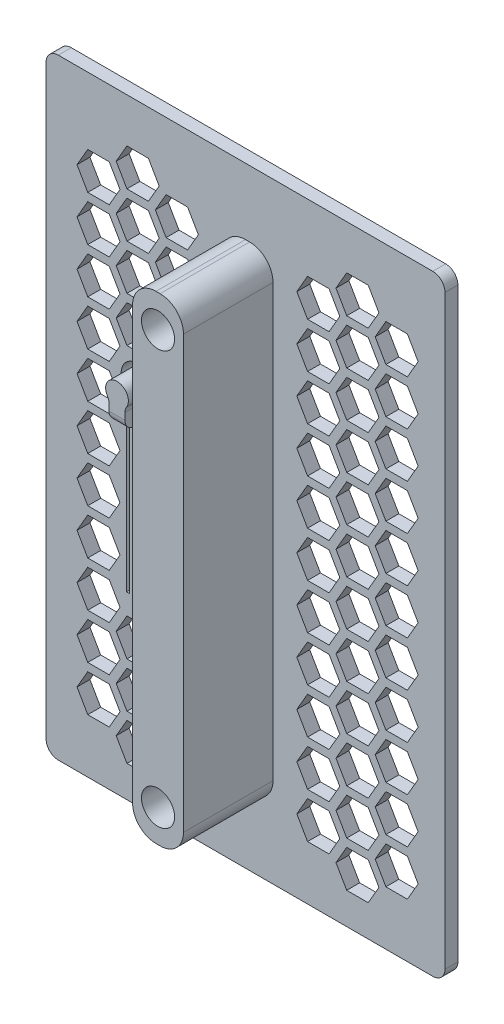
from build123d import *

# Parameters (mm, degrees)
SKETCH1_W           = 49
SKETCH1_H           = 75
BOSS_EXTRUDE1_DEPTH = 1.5875
BOSS_EXTRUDE2_DEPTH = 11
SKETCH3_R           = 2.032
CUT_EXTRUDE1_DEPTH  = 9.525
FILLET1_R           = 1.5
CUT_EXTRUDE2_DEPTH  = 47.52897115
BOSS_EXTRUDE3_DEPTH = 2.54
FILLET2_R           = 1.27


with BuildPart() as part:
    # Sketch1 → Boss-Extrude1 (new body)
    with BuildSketch(Plane.XY):
        Rectangle(SKETCH1_W, SKETCH1_H)
    extrude(amount=BOSS_EXTRUDE1_DEPTH)

    # Sketch2 → Boss-Extrude2 (add)
    with BuildSketch(Plane.XY.offset(1.5875)):
        with BuildLine():
            Line((0, -29.373), (0.5, -29.373))
            ThreePointArc((0.5, -29.373), (2.531517782, -28.531517782), (3.373, -26.5))
            Line((3.373, -26.5), (3.373, 26.5))
            ThreePointArc((3.373, 26.5), (2.531517782, 28.531517782), (0.5, 29.373))
            Line((0.5, 29.373), (0, 29.373))
            ThreePointArc((0, 29.373), (-2.031517782, 28.531517782), (-2.873, 26.5))
            Line((-2.873, 26.5), (-2.873, -26.5))
            ThreePointArc((-2.873, -26.5), (-2.031517782, -28.531517782), (0, -29.373))
        make_face()
    extrude(amount=BOSS_EXTRUDE2_DEPTH)

    # Sketch3 → Cut-Extrude1 (cut)
    with BuildSketch(Plane.XY.offset(12.5875)):
        with Locations((0.25, 25.4)):
            Circle(SKETCH3_R)
        with Locations((0.25, -25.4)):
            Circle(SKETCH3_R)
    extrude(amount=-CUT_EXTRUDE1_DEPTH, mode=Mode.SUBTRACT)

    # Fillet1
    fillet1_edges = [part.edges().sort_by_distance(p)[0] for p in [
        (-24.5, 37.5, 0.79375),
        (24.5, 37.5, 0.79375),
        (24.5, -37.5, 0.79375),
        (-24.5, -37.5, 0.79375),
    ]]
    fillet(fillet1_edges, radius=FILLET1_R)

    # Sketch4 → Cut-Extrude2 (cut, through all)
    with BuildSketch(Plane(origin=(0, 0, 0), x_dir=(-1, 0, 0), z_dir=(0, 0, -1))):
        Polygon((-16.389645431, -31.346033363), (-15.069822715, -33.632033363), (-12.430177285, -33.632033363), (-11.110354569, -31.346033363), (-12.430177285, -29.060033363), (-15.069822715, -29.060033363), align=None)
        Polygon((-21.201499081, -28.567908363), (-19.881676365, -30.853908363), (-17.242030934, -30.853908363), (-15.922208219, -28.567908363), (-17.242030934, -26.281908363), (-19.881676365, -26.281908363), align=None)
        Polygon((-10.257969066, -30.853908363), (-7.618323635, -30.853908363), (-6.298500919, -28.567908363), (-7.618323635, -26.281908363), (-10.257969066, -26.281908363), (-11.577791781, -28.567908363), align=None)
        Polygon((-10.257969066, -20.725658363), (-11.577791781, -23.011658363), (-10.257969066, -25.297658363), (-7.618323635, -25.297658363), (-6.298500919, -23.011658363), (-7.618323635, -20.725658363), align=None)
        Polygon((-11.110354569, -25.789783363), (-12.430177285, -23.503783363), (-15.069822715, -23.503783363), (-16.389645431, -25.789783363), (-15.069822715, -28.075783363), (-12.430177285, -28.075783363), align=None)
        Polygon((-17.242030934, -25.297658363), (-15.922208219, -23.011658363), (-17.242030934, -20.725658363), (-19.881676365, -20.725658363), (-21.201499081, -23.011658363), (-19.881676365, -25.297658363), align=None)
        Polygon((-10.257969066, -15.169408363), (-11.577791781, -17.455408363), (-10.257969066, -19.741408363), (-7.618323635, -19.741408363), (-6.298500919, -17.455408363), (-7.618323635, -15.169408363), align=None)
        Polygon((-11.110354569, -20.233533363), (-12.430177285, -17.947533363), (-15.069822715, -17.947533363), (-16.389645431, -20.233533363), (-15.069822715, -22.519533363), (-12.430177285, -22.519533363), align=None)
        Polygon((-17.242030934, -19.741408363), (-15.922208219, -17.455408363), (-17.242030934, -15.169408363), (-19.881676365, -15.169408363), (-21.201499081, -17.455408363), (-19.881676365, -19.741408363), align=None)
        Polygon((-10.257969066, -9.613158363), (-11.577791781, -11.899158363), (-10.257969066, -14.185158363), (-7.618323635, -14.185158363), (-6.298500919, -11.899158363), (-7.618323635, -9.613158363), align=None)
        Polygon((-11.110354569, -14.677283363), (-12.430177285, -12.391283363), (-15.069822715, -12.391283363), (-16.389645431, -14.677283363), (-15.069822715, -16.963283363), (-12.430177285, -16.963283363), align=None)
        Polygon((-17.242030934, -14.185158363), (-15.922208219, -11.899158363), (-17.242030934, -9.613158363), (-19.881676365, -9.613158363), (-21.201499081, -11.899158363), (-19.881676365, -14.185158363), align=None)
        Polygon((-10.257969066, -4.056908363), (-11.577791781, -6.342908363), (-10.257969066, -8.628908363), (-7.618323635, -8.628908363), (-6.298500919, -6.342908363), (-7.618323635, -4.056908363), align=None)
        Polygon((-11.110354569, -9.121033363), (-12.430177285, -6.835033363), (-15.069822715, -6.835033363), (-16.389645431, -9.121033363), (-15.069822715, -11.407033363), (-12.430177285, -11.407033363), align=None)
        Polygon((-17.242030934, -8.628908363), (-15.922208219, -6.342908363), (-17.242030934, -4.056908363), (-19.881676365, -4.056908363), (-21.201499081, -6.342908363), (-19.881676365, -8.628908363), align=None)
        Polygon((-10.257969066, 1.499341637), (-11.577791781, -0.786658363), (-10.257969066, -3.072658363), (-7.618323635, -3.072658363), (-6.298500919, -0.786658363), (-7.618323635, 1.499341637), align=None)
        Polygon((-11.110354569, -3.564783363), (-12.430177285, -1.278783363), (-15.069822715, -1.278783363), (-16.389645431, -3.564783363), (-15.069822715, -5.850783363), (-12.430177285, -5.850783363), align=None)
        Polygon((-17.242030934, -3.072658363), (-15.922208219, -0.786658363), (-17.242030934, 1.499341637), (-19.881676365, 1.499341637), (-21.201499081, -0.786658363), (-19.881676365, -3.072658363), align=None)
        Polygon((-10.257969066, 7.055591637), (-11.577791781, 4.769591637), (-10.257969066, 2.483591637), (-7.618323635, 2.483591637), (-6.298500919, 4.769591637), (-7.618323635, 7.055591637), align=None)
        Polygon((-11.110354569, 1.991466637), (-12.430177285, 4.277466637), (-15.069822715, 4.277466637), (-16.389645431, 1.991466637), (-15.069822715, -0.294533363), (-12.430177285, -0.294533363), align=None)
        Polygon((-17.242030934, 2.483591637), (-15.922208219, 4.769591637), (-17.242030934, 7.055591637), (-19.881676365, 7.055591637), (-21.201499081, 4.769591637), (-19.881676365, 2.483591637), align=None)
        Polygon((-10.257969066, 12.611841637), (-11.577791781, 10.325841637), (-10.257969066, 8.039841637), (-7.618323635, 8.039841637), (-6.298500919, 10.325841637), (-7.618323635, 12.611841637), align=None)
        Polygon((-11.110354569, 7.547716637), (-12.430177285, 9.833716637), (-15.069822715, 9.833716637), (-16.389645431, 7.547716637), (-15.069822715, 5.261716637), (-12.430177285, 5.261716637), align=None)
        Polygon((-17.242030934, 8.039841637), (-15.922208219, 10.325841637), (-17.242030934, 12.611841637), (-19.881676365, 12.611841637), (-21.201499081, 10.325841637), (-19.881676365, 8.039841637), align=None)
        Polygon((-10.257969066, 18.168091637), (-11.577791781, 15.882091637), (-10.257969066, 13.596091637), (-7.618323635, 13.596091637), (-6.298500919, 15.882091637), (-7.618323635, 18.168091637), align=None)
        Polygon((-11.110354569, 13.103966637), (-12.430177285, 15.389966637), (-15.069822715, 15.389966637), (-16.389645431, 13.103966637), (-15.069822715, 10.817966637), (-12.430177285, 10.817966637), align=None)
        Polygon((-17.242030934, 13.596091637), (-15.922208219, 15.882091637), (-17.242030934, 18.168091637), (-19.881676365, 18.168091637), (-21.201499081, 15.882091637), (-19.881676365, 13.596091637), align=None)
        Polygon((-10.257969066, 23.724341637), (-11.577791781, 21.438341637), (-10.257969066, 19.152341637), (-7.618323635, 19.152341637), (-6.298500919, 21.438341637), (-7.618323635, 23.724341637), align=None)
        Polygon((-11.110354569, 18.660216637), (-12.430177285, 20.946216637), (-15.069822715, 20.946216637), (-16.389645431, 18.660216637), (-15.069822715, 16.374216637), (-12.430177285, 16.374216637), align=None)
        Polygon((-17.242030934, 19.152341637), (-15.922208219, 21.438341637), (-17.242030934, 23.724341637), (-19.881676365, 23.724341637), (-21.201499081, 21.438341637), (-19.881676365, 19.152341637), align=None)
        Polygon((19.381676365, 19.152341637), (16.742030934, 19.152341637), (15.422208219, 21.438341637), (16.742030934, 23.724341637), (19.381676365, 23.724341637), (20.701499081, 21.438341637), align=None)
        Polygon((11.930177285, 16.374216637), (10.610354569, 18.660216637), (11.930177285, 20.946216637), (14.569822715, 20.946216637), (15.889645431, 18.660216637), (14.569822715, 16.374216637), align=None)
        Polygon((11.077791781, 21.438341637), (9.757969066, 19.152341637), (7.118323635, 19.152341637), (5.798500919, 21.438341637), (7.118323635, 23.724341637), (9.757969066, 23.724341637), align=None)
        Polygon((19.381676365, 13.596091637), (16.742030934, 13.596091637), (15.422208219, 15.882091637), (16.742030934, 18.168091637), (19.381676365, 18.168091637), (20.701499081, 15.882091637), align=None)
        Polygon((11.077791781, 15.882091637), (9.757969066, 13.596091637), (7.118323635, 13.596091637), (5.798500919, 15.882091637), (7.118323635, 18.168091637), (9.757969066, 18.168091637), align=None)
        Polygon((19.381676365, 8.039841637), (16.742030934, 8.039841637), (15.422208219, 10.325841637), (16.742030934, 12.611841637), (19.381676365, 12.611841637), (20.701499081, 10.325841637), align=None)
        Polygon((11.077791781, 10.325841637), (9.757969066, 8.039841637), (7.118323635, 8.039841637), (5.798500919, 10.325841637), (7.118323635, 12.611841637), (9.757969066, 12.611841637), align=None)
        Polygon((19.381676365, 2.483591637), (16.742030934, 2.483591637), (15.422208219, 4.769591637), (16.742030934, 7.055591637), (19.381676365, 7.055591637), (20.701499081, 4.769591637), align=None)
        Polygon((11.077791781, 4.769591637), (9.757969066, 2.483591637), (7.118323635, 2.483591637), (5.798500919, 4.769591637), (7.118323635, 7.055591637), (9.757969066, 7.055591637), align=None)
        Polygon((19.381676365, -3.072658363), (16.742030934, -3.072658363), (15.422208219, -0.786658363), (16.742030934, 1.499341637), (19.381676365, 1.499341637), (20.701499081, -0.786658363), align=None)
        Polygon((11.077791781, -0.786658363), (9.757969066, -3.072658363), (7.118323635, -3.072658363), (5.798500919, -0.786658363), (7.118323635, 1.499341637), (9.757969066, 1.499341637), align=None)
        Polygon((19.381676365, -8.628908363), (16.742030934, -8.628908363), (15.422208219, -6.342908363), (16.742030934, -4.056908363), (19.381676365, -4.056908363), (20.701499081, -6.342908363), align=None)
        Polygon((11.077791781, -6.342908363), (9.757969066, -8.628908363), (7.118323635, -8.628908363), (5.798500919, -6.342908363), (7.118323635, -4.056908363), (9.757969066, -4.056908363), align=None)
        Polygon((19.381676365, -14.185158363), (16.742030934, -14.185158363), (15.422208219, -11.899158363), (16.742030934, -9.613158363), (19.381676365, -9.613158363), (20.701499081, -11.899158363), align=None)
        Polygon((11.077791781, -11.899158363), (9.757969066, -14.185158363), (7.118323635, -14.185158363), (5.798500919, -11.899158363), (7.118323635, -9.613158363), (9.757969066, -9.613158363), align=None)
        Polygon((19.381676365, -19.741408363), (16.742030934, -19.741408363), (15.422208219, -17.455408363), (16.742030934, -15.169408363), (19.381676365, -15.169408363), (20.701499081, -17.455408363), align=None)
        Polygon((11.077791781, -17.455408363), (9.757969066, -19.741408363), (7.118323635, -19.741408363), (5.798500919, -17.455408363), (7.118323635, -15.169408363), (9.757969066, -15.169408363), align=None)
        Polygon((19.381676365, -25.297658363), (16.742030934, -25.297658363), (15.422208219, -23.011658363), (16.742030934, -20.725658363), (19.381676365, -20.725658363), (20.701499081, -23.011658363), align=None)
        Polygon((11.930177285, -28.075783363), (10.610354569, -25.789783363), (11.930177285, -23.503783363), (14.569822715, -23.503783363), (15.889645431, -25.789783363), (14.569822715, -28.075783363), align=None)
        Polygon((11.077791781, -23.011658363), (9.757969066, -25.297658363), (7.118323635, -25.297658363), (5.798500919, -23.011658363), (7.118323635, -20.725658363), (9.757969066, -20.725658363), align=None)
        Polygon((11.077791781, -28.567908363), (9.757969066, -30.853908363), (7.118323635, -30.853908363), (5.798500919, -28.567908363), (7.118323635, -26.281908363), (9.757969066, -26.281908363), align=None)
        Polygon((19.381676365, -26.281908363), (20.701499081, -28.567908363), (19.381676365, -30.853908363), (16.742030934, -30.853908363), (15.422208219, -28.567908363), (16.742030934, -26.281908363), align=None)
        Polygon((14.569822715, -29.060033363), (15.889645431, -31.346033363), (14.569822715, -33.632033363), (11.930177285, -33.632033363), (10.610354569, -31.346033363), (11.930177285, -29.060033363), align=None)
        Polygon((11.930177285, 10.817966637), (10.610354569, 13.103966637), (11.930177285, 15.389966637), (14.569822715, 15.389966637), (15.889645431, 13.103966637), (14.569822715, 10.817966637), align=None)
        Polygon((-10.257969066, 29.280591637), (-11.577791781, 26.994591637), (-10.257969066, 24.708591637), (-7.618323635, 24.708591637), (-6.298500919, 26.994591637), (-7.618323635, 29.280591637), align=None)
        Polygon((11.930177285, -22.519533363), (10.610354569, -20.233533363), (11.930177285, -17.947533363), (14.569822715, -17.947533363), (15.889645431, -20.233533363), (14.569822715, -22.519533363), align=None)
        Polygon((-11.110354569, 24.216466637), (-12.430177285, 26.502466637), (-15.069822715, 26.502466637), (-16.389645431, 24.216466637), (-15.069822715, 21.930466637), (-12.430177285, 21.930466637), align=None)
        Polygon((-17.242030934, 24.708591637), (-15.922208219, 26.994591637), (-17.242030934, 29.280591637), (-19.881676365, 29.280591637), (-21.201499081, 26.994591637), (-19.881676365, 24.708591637), align=None)
        Polygon((7.118323635, 24.708591637), (5.798500919, 26.994591637), (7.118323635, 29.280591637), (9.757969066, 29.280591637), (11.077791781, 26.994591637), (9.757969066, 24.708591637), align=None)
        Polygon((15.889645431, 24.216466637), (14.569822715, 21.930466637), (11.930177285, 21.930466637), (10.610354569, 24.216466637), (11.930177285, 26.502466637), (14.569822715, 26.502466637), align=None)
        Polygon((20.701499081, 26.994591637), (19.381676365, 24.708591637), (16.742030934, 24.708591637), (15.422208219, 26.994591637), (16.742030934, 29.280591637), (19.381676365, 29.280591637), align=None)
        with BuildLine():
            Line((11.871541781, -15.407533363), (11.871541781, 6.054774261))
            ThreePointArc((11.871541781, 6.054774261), (13.25, 9.579716637), (14.628458219, 6.054774261))
            Line((14.628458219, 6.054774261), (14.628458219, -15.407533363))
            Line((14.628458219, -15.407533363), (14.231583219, -15.407533363))
            Line((14.231583219, -15.407533363), (14.231583219, 6.553682742))
            ThreePointArc((14.231583219, 6.553682742), (13.25, 8.944716637), (12.268416781, 6.553682742))
            Line((12.268416781, 6.553682742), (12.268416781, -15.407533363))
            Line((12.268416781, -15.407533363), (11.871541781, -15.407533363))
        make_face()
        Polygon((-11.110354569, 29.772716637), (-12.430177285, 32.058716637), (-15.069822715, 32.058716637), (-16.389645431, 29.772716637), (-15.069822715, 27.486716637), (-12.430177285, 27.486716637), align=None)
        Polygon((10.610354569, 29.772716637), (11.930177285, 27.486716637), (14.569822715, 27.486716637), (15.889645431, 29.772716637), (14.569822715, 32.058716637), (11.930177285, 32.058716637), align=None)
    extrude(amount=-CUT_EXTRUDE2_DEPTH, mode=Mode.SUBTRACT)

    # Sketch5 → Boss-Extrude3 (add)
    with BuildSketch(Plane.XY.offset(1.5875)):
        with BuildLine():
            Line((-14.231583219, 6.553682742), (-14.231583219, 4.013682742))
            Line((-14.231583219, 4.013682742), (-12.268416781, 4.013682742))
            Line((-12.268416781, 4.013682742), (-12.268416781, 6.553682742))
            ThreePointArc((-12.268416781, 6.553682742), (-13.25, 8.944716637), (-14.231583219, 6.553682742))
        make_face()
    extrude(amount=BOSS_EXTRUDE3_DEPTH)

    # Fillet2
    fillet2_edges = [part.edges().sort_by_distance(p)[0] for p in [
        (-13.25, 4.013682742, 4.1275),
        (-13.25, 4.013682742, 1.5875),
        (-14.628458219, 6.054774261, 0.79375),
        (-11.871541781, 6.054774261, 0.79375),
        (-14.231583219, 6.553682742, 2.8575),
        (-12.268416781, 6.553682742, 2.8575),
    ]]
    fillet(fillet2_edges, radius=FILLET2_R - 0.0001)  # a hair under: the kernel refuses the full size


solid = part.part
